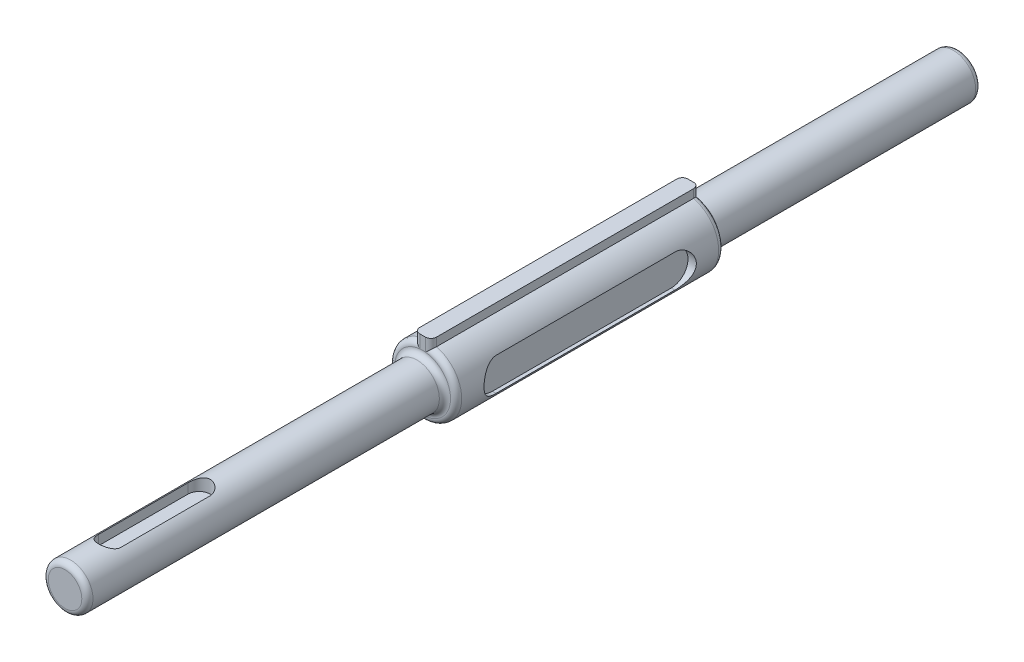
from build123d import *

# Parameters (mm, degrees)
BOSS_EXTRUDE1_DEPTH = 38.1
SKETCH2_R           = 3.175
BOSS_EXTRUDE2_DEPTH = 38.1
BOSS_EXTRUDE3_START = 50.8
SKETCH3_R           = 3.175
BOSS_EXTRUDE3_DEPTH = 50.8
FILLET1_R           = 0.79375
CUT_EXTRUDE1_DEPTH  = 1.190625
CUT_EXTRUDE2_DEPTH  = 4.445


with BuildPart() as part:
    # Sketch1 → Boss-Extrude1 (new body)
    with BuildSketch(Plane.XY):
        with BuildLine():
            Line((1.190625, 4.611270797), (1.190625, 5.801895797))
            Line((1.190625, 5.801895797), (-1.190625, 5.801895797))
            Line((-1.190625, 5.801895797), (-1.190625, 4.611270797))
            ThreePointArc((-1.190625, 4.611270797), (0, -4.7625), (1.190625, 4.611270797))
        make_face()
    extrude(amount=BOSS_EXTRUDE1_DEPTH)

    # Sketch2 → Boss-Extrude2 (add)
    with BuildSketch(Plane(origin=(0, 0, 0), x_dir=(-1, 0, 0), z_dir=(0, 0, -1))):
        with Locations(Location((0, 0, 0), (0, 0, 180))):
            Circle(SKETCH2_R)
    extrude(amount=BOSS_EXTRUDE2_DEPTH)

    # Sketch3 → Boss-Extrude3 (add)
    with BuildSketch(Plane.XY.offset(38.1).offset(BOSS_EXTRUDE3_START)):
        Circle(SKETCH3_R)
    extrude(amount=-BOSS_EXTRUDE3_DEPTH)

    # Fillet1
    fillet1_edges = [part.edges().sort_by_distance(p)[0] for p in [
        (-3.175, 0, 0),
        (-3.175, 0, -38.1),
        (-1.190625, 5.206583297, 38.1),
        (-3.175, 0, 38.1),
        (-3.175, 0, 88.9),
        (0, -4.7625, 38.1),
        (-1.190625, 5.206583297, 0),
        (1.190625, 5.206583297, 0),
        (0, -4.7625, 0),
        (1.190625, 5.206583297, 38.1),
    ]]
    fillet(fillet1_edges, radius=FILLET1_R - 0.0001)  # a hair under: the kernel refuses the full size

    # Sketch4 → Cut-Extrude1 (cut)
    with BuildSketch(Plane(origin=(4.7625, 0, 0), x_dir=(0, 0, -1), z_dir=(1, 0, 0))):
        with BuildLine():
            Line((-31.75, 2.305635398), (-6.35, 2.305635398))
            ThreePointArc((-6.35, 2.305635398), (-3.96875, -0.075614602), (-6.35, -2.456864602))
            Line((-6.35, -2.456864602), (-31.75, -2.456864602))
            ThreePointArc((-31.75, -2.456864602), (-34.13125, -0.075614602), (-31.75, 2.305635398))
        make_face()
    extrude(amount=-CUT_EXTRUDE1_DEPTH, mode=Mode.SUBTRACT)

    # Sketch5 → Cut-Extrude2 (cut)
    with BuildSketch(Plane(origin=(0, 5.801895797, 0), x_dir=(1, 0, 0), z_dir=(0, 1, 0))):
        with BuildLine():
            Line((-1.5875, -82.55), (-1.5875, -69.85))
            ThreePointArc((-1.5875, -69.85), (0, -68.2625), (1.5875, -69.85))
            Line((1.5875, -69.85), (1.5875, -82.55))
            ThreePointArc((1.5875, -82.55), (0, -84.1375), (-1.5875, -82.55))
        make_face()
    extrude(amount=-CUT_EXTRUDE2_DEPTH, mode=Mode.SUBTRACT)


solid = part.part
